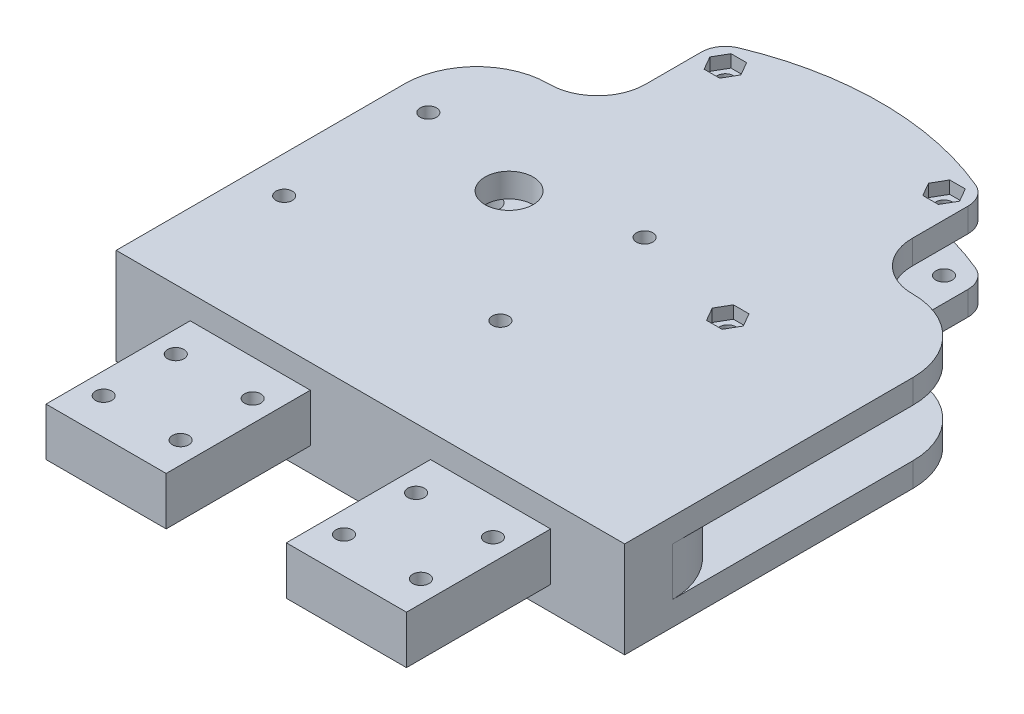
from build123d import *

# Parameters (mm, degrees)
SKETCH1_R               = 2.3
SKETCH1_R_2             = 1.7
BOSS_EXTRUDE2_DEPTH     = 5
SKETCH2_R               = 1.7
BOSS_EXTRUDE4_DEPTH     = 5
BOSS_EXTRUDE7_DEPTH     = 5
BOSS_EXTRUDE8_DEPTH     = 10
BOSS_EXTRUDE9_START     = 5
SKETCH6_R               = 1.7
SKETCH6_R_2             = 5
BOSS_EXTRUDE9_DEPTH     = 5
SKETCH7_W               = 10
SKETCH7_H               = 10
BOSS_EXTRUDE10_DEPTH    = 30
SKETCH9_W               = 7.5
SKETCH9_H               = 30
SKETCH9_R               = 1.7
BOSS_EXTRUDE11_DEPTH    = 10
FILLET1_R               = 10
CUT_EXTRUDE1_DEPTH      = 2.7
CUT_EXTRUDE1_DEPTH_BACK = 2.6
CUT_EXTRUDE2_DEPTH      = 2.7
CUT_EXTRUDE2_DEPTH_BACK = 2.6
CUT_EXTRUDE4_DEPTH      = 2.6
BOSS_EXTRUDE12_DEPTH    = 10


with BuildPart() as part:
    # Sketch1 → Boss-Extrude2 (new body)
    with BuildSketch(Plane(origin=(0, 0, 0), x_dir=(1, 0, 0), z_dir=(0, 1, 0))):
        with BuildLine():
            Line((15.15, -32.7), (-15.15, -32.7))
            ThreePointArc((-15.15, -32.7), (-25.756601718, -28.306601718), (-30.15, -17.7))
            Line((-30.15, -17.7), (-30.15, 17.7))
            ThreePointArc((-30.15, 17.7), (-25.756601718, 28.306601718), (-15.15, 32.7))
            Line((-15.15, 32.7), (15.15, 32.7))
            ThreePointArc((15.15, 32.7), (25.756601718, 28.306601718), (30.15, 17.7))
            Line((30.15, 17.7), (30.15, -17.7))
            ThreePointArc((30.15, -17.7), (25.756601718, -28.306601718), (15.15, -32.7))
        make_face()
        with Locations(Location((-15, 20, 0), (0, 0, 270))):
            Circle(SKETCH1_R, mode=Mode.SUBTRACT)
        with Locations(Location((-25, 0, 0), (0, 0, 270))):
            Circle(SKETCH1_R, mode=Mode.SUBTRACT)
        with Locations(Location((-15, -20, 0), (0, 0, 270))):
            Circle(SKETCH1_R, mode=Mode.SUBTRACT)
        with Locations(Location((-22.5, 15, 0), (0, 0, 270))):
            Circle(SKETCH1_R_2, mode=Mode.SUBTRACT)
        with Locations(Location((-22.5, -15, 0), (0, 0, 270))):
            Circle(SKETCH1_R_2, mode=Mode.SUBTRACT)
        with Locations(Location((15, -20, 0), (0, 0, 90))):
            Circle(SKETCH1_R, mode=Mode.SUBTRACT)
        with Locations(Location((22.5, -15, 0), (0, 0, 90))):
            Circle(SKETCH1_R_2, mode=Mode.SUBTRACT)
        with Locations(Location((25, 0, 0), (0, 0, 90))):
            Circle(SKETCH1_R, mode=Mode.SUBTRACT)
        with Locations(Location((22.5, 15, 0), (0, 0, 90))):
            Circle(SKETCH1_R_2, mode=Mode.SUBTRACT)
        with Locations(Location((15, 20, 0), (0, 0, 90))):
            Circle(SKETCH1_R, mode=Mode.SUBTRACT)
        with BuildLine():
            Line((-9, 4.716333345), (-9, -16.9))
            Line((-9, -16.9), (9, -16.9))
            Line((9, -16.9), (9, 4.716333345))
            ThreePointArc((9, 4.716333345), (0, 19.4), (-9, 4.716333345))
        make_face(mode=Mode.SUBTRACT)
    extrude(amount=BOSS_EXTRUDE2_DEPTH)

    # Sketch2 → Boss-Extrude4 (add)
    with BuildSketch(Plane(origin=(0, 5, 0), x_dir=(1, 0, 0), z_dir=(0, 1, 0))):
        with BuildLine():
            Line((60.65, -32.7), (15.35, -32.7))
            Line((15.35, -32.7), (28.35, -18.600497512))
            Line((28.35, -18.600497512), (28.35, 18.600497512))
            Line((28.35, 18.600497512), (15.35, 32.7))
            Line((15.35, 32.7), (-5, 32.7))
            Line((-5, 32.7), (-5, 54.3))
            ThreePointArc((-5, 54.3), (-4.162967345, 57.069422843), (-1.932118848, 58.911606744))
            ThreePointArc((-1.932118848, 58.911606744), (22.75, 63.873189993), (47.432118848, 58.911606744))
            ThreePointArc((47.432118848, 58.911606744), (49.662967345, 57.069422843), (50.5, 54.3))
            Line((50.5, 54.3), (50.5, 32.7))
            Line((50.5, 32.7), (60.65, 32.7))
            ThreePointArc((60.65, 32.7), (71.256601718, 28.306601718), (75.65, 17.7))
            Line((75.65, 17.7), (75.65, -17.7))
            ThreePointArc((75.65, -17.7), (71.256601718, -28.306601718), (60.65, -32.7))
        make_face()
        with Locations(Location((45.5, 9.3, 0), (0, 0, 270))):
            Circle(SKETCH2_R, mode=Mode.SUBTRACT)
        with Locations(Location((45.5, 54.3, 0), (0, 0, 270))):
            Circle(SKETCH2_R, mode=Mode.SUBTRACT)
        with Locations(Location((0, 54.3, 0), (0, 0, 270))):
            Circle(SKETCH2_R, mode=Mode.SUBTRACT)
    extrude(amount=-BOSS_EXTRUDE4_DEPTH)

    # Sketch4 → Boss-Extrude7 (add)
    with BuildSketch(Plane(origin=(0, 5, 0), x_dir=(1, 0, 0), z_dir=(0, 1, 0))):
        Polygon((-30.15, -17.7), (-15.15, -32.7), (60.65, -32.7), (75.65, -17.7), (75.65, -42.3), (-30.15, -42.3), align=None)
    extrude(amount=-BOSS_EXTRUDE7_DEPTH)

    # Sketch5 → Boss-Extrude8 (add)
    with BuildSketch(Plane(origin=(0, 5, 0), x_dir=(1, 0, 0), z_dir=(0, 1, 0))):
        with BuildLine():
            Line((-30.15, -42.3), (75.65, -42.3))
            Line((75.65, -42.3), (75.65, -32.3))
            ThreePointArc((75.65, -32.3), (71.256601718, -21.693398282), (60.65, -17.3))
            Line((60.65, -17.3), (-15.15, -17.3))
            ThreePointArc((-15.15, -17.3), (-25.756601718, -21.693398282), (-30.15, -32.3))
            Line((-30.15, -32.3), (-30.15, -42.3))
        make_face()
    extrude(amount=BOSS_EXTRUDE8_DEPTH)

    # Sketch6 → Boss-Extrude9 (add)
    with BuildSketch(Plane(origin=(0, 15, 0), x_dir=(1, 0, 0), z_dir=(0, 1, 0)).offset(BOSS_EXTRUDE9_START)):
        with BuildLine():
            Line((-30.15, -42.3), (-30.15, 17.7))
            ThreePointArc((-30.15, 17.7), (-25.756601718, 28.306601718), (-15.15, 32.7))
            Line((-15.15, 32.7), (-5, 32.7))
            Line((-5, 32.7), (-5, 54.3))
            ThreePointArc((-5, 54.3), (-4.162967345, 57.069422843), (-1.932118848, 58.911606744))
            ThreePointArc((-1.932118848, 58.911606744), (22.75, 63.873189993), (47.432118848, 58.911606744))
            ThreePointArc((47.432118848, 58.911606744), (49.662967345, 57.069422843), (50.5, 54.3))
            Line((50.5, 54.3), (50.5, 32.7))
            Line((50.5, 32.7), (60.65, 32.7))
            ThreePointArc((60.65, 32.7), (71.256601718, 28.306601718), (75.65, 17.7))
            Line((75.65, 17.7), (75.65, -42.3))
            Line((75.65, -42.3), (-30.15, -42.3))
        make_face()
        with Locations(Location((-22.5, 15, 0), (0, 0, 270))):
            Circle(SKETCH6_R, mode=Mode.SUBTRACT)
        with Locations(Location((-22.5, -15, 0), (0, 0, 270))):
            Circle(SKETCH6_R, mode=Mode.SUBTRACT)
        with Locations(Location((22.5, -15, 0), (0, 0, 90))):
            Circle(SKETCH6_R, mode=Mode.SUBTRACT)
        with Locations(Location((22.5, 15, 0), (0, 0, 90))):
            Circle(SKETCH6_R, mode=Mode.SUBTRACT)
        with Locations(Location((45.5, 9.3, 0), (0, 0, 270))):
            Circle(SKETCH6_R, mode=Mode.SUBTRACT)
        with Locations(Location((0, 9.3, 0), (0, 0, 270))):
            Circle(SKETCH6_R_2, mode=Mode.SUBTRACT)
        with Locations(Location((45.5, 54.3, 0), (0, 0, 270))):
            Circle(SKETCH6_R, mode=Mode.SUBTRACT)
        with Locations(Location((0, 54.3, 0), (0, 0, 270))):
            Circle(SKETCH6_R, mode=Mode.SUBTRACT)
    extrude(amount=-BOSS_EXTRUDE9_DEPTH)

    # Sketch7 → Boss-Extrude10 (add)
    with BuildSketch(Plane.XY.offset(42.3)):
        with Locations((-2.25, 10)):
            Rectangle(SKETCH7_W, SKETCH7_H)
        with Locations((47.75, 10)):
            Rectangle(SKETCH7_W, SKETCH7_H)
    extrude(amount=BOSS_EXTRUDE10_DEPTH)

    # Sketch9 → Boss-Extrude11 (add)
    # profile 1 of 4: a face of its own
    with BuildSketch(Plane(origin=(0, 15, 0), x_dir=(1, 0, 0), z_dir=(0, 1, 0))):
        with Locations((-11, -57.3)):
            Rectangle(SKETCH9_W, SKETCH9_H)
        with Locations(Location((-10.25, -49.8, 0), (0, 0, 180))):
            Circle(SKETCH9_R, mode=Mode.SUBTRACT)
        with Locations((-10.25, -64.8)):
            Circle(SKETCH9_R, mode=Mode.SUBTRACT)
    # profile 2 of 4: a face of its own
    with BuildSketch(Plane(origin=(0, 15, 0), x_dir=(1, 0, 0), z_dir=(0, 1, 0))):
        with Locations((6.5, -57.3)):
            Rectangle(SKETCH9_W, SKETCH9_H)
        with Locations(Location((5.75, -64.8, 0), (0, 0, 180))):
            Circle(SKETCH9_R, mode=Mode.SUBTRACT)
        with Locations((5.75, -49.8)):
            Circle(SKETCH9_R, mode=Mode.SUBTRACT)
    # profile 3 of 4: a face of its own
    with BuildSketch(Plane(origin=(0, 15, 0), x_dir=(1, 0, 0), z_dir=(0, 1, 0))):
        with Locations((39, -57.3)):
            Rectangle(SKETCH9_W, SKETCH9_H)
        with Locations((39.75, -64.8)):
            Circle(SKETCH9_R, mode=Mode.SUBTRACT)
        with Locations(Location((39.75, -49.8, 0), (0, 0, 180))):
            Circle(SKETCH9_R, mode=Mode.SUBTRACT)
    # profile 4 of 4: a face of its own
    with BuildSketch(Plane(origin=(0, 15, 0), x_dir=(1, 0, 0), z_dir=(0, 1, 0))):
        with Locations((56.5, -57.3)):
            Rectangle(SKETCH9_W, SKETCH9_H)
        with Locations(Location((55.75, -64.8, 0), (0, 0, 180))):
            Circle(SKETCH9_R, mode=Mode.SUBTRACT)
        with Locations((55.75, -49.8)):
            Circle(SKETCH9_R, mode=Mode.SUBTRACT)
    extrude(amount=-BOSS_EXTRUDE11_DEPTH)

    # Fillet1
    # the kernel refuses this fillet: 10 mm, written as the material it adds along each edge
    with BuildSketch(Plane(origin=(-5, 30, -32.7), x_dir=(0, 0, -1), z_dir=(0, -1, 0))) as fillet1_piece_1_section:
        with BuildLine():
            CenterArc((FILLET1_R, -FILLET1_R), FILLET1_R, 90, 90)
            Line((0, -FILLET1_R), (0, 0))
            Line((0, 0), (FILLET1_R, 0))
        make_face()
    fillet1_piece_1 = extrude(amount=30, mode=Mode.PRIVATE)
    fillet1_piece_1 = split(fillet1_piece_1, bisect_by=Plane(origin=(-7.263951143, 15, -34.963951143), z_dir=(0, 1, 0)), keep=Keep.TOP, mode=Mode.PRIVATE)
    fillet1_piece_1 = split(fillet1_piece_1, bisect_by=Plane(origin=(-7.263951143, 20, -34.963951143), z_dir=(0, -1, 0)), keep=Keep.TOP, mode=Mode.PRIVATE)
    add(fillet1_piece_1)
    with BuildSketch(Plane(origin=(-5, 5, -32.7), x_dir=(0, 0, -1), z_dir=(0, -1, 0)), Plane(origin=(50.5, 5, -32.7), x_dir=(1, 0, 0), z_dir=(0, -1, 0))) as fillet1_piece_2:
        with BuildLine():
            CenterArc((FILLET1_R, -FILLET1_R), FILLET1_R, 90, 90)
            Line((0, -FILLET1_R), (0, 0))
            Line((0, 0), (FILLET1_R, 0))
        make_face()
    extrude(amount=5)
    with BuildSketch(Plane(origin=(50.5, 30, -32.7), x_dir=(1, 0, 0), z_dir=(0, -1, 0))) as fillet1_piece_3_section:
        with BuildLine():
            CenterArc((FILLET1_R, -FILLET1_R), FILLET1_R, 90, 90)
            Line((0, -FILLET1_R), (0, 0))
            Line((0, 0), (FILLET1_R, 0))
        make_face()
    fillet1_piece_3 = extrude(amount=30, mode=Mode.PRIVATE)
    fillet1_piece_3 = split(fillet1_piece_3, bisect_by=Plane(origin=(52.763951143, 15, -34.963951143), z_dir=(0, 1, 0)), keep=Keep.TOP, mode=Mode.PRIVATE)
    fillet1_piece_3 = split(fillet1_piece_3, bisect_by=Plane(origin=(52.763951143, 20, -34.963951143), z_dir=(0, -1, 0)), keep=Keep.TOP, mode=Mode.PRIVATE)
    add(fillet1_piece_3)
    with BuildSketch(Plane(origin=(50.5, 20, -32.7), x_dir=(0, 0, -1), z_dir=(0, -1, 0)), Plane(origin=(-5, 20, -32.7), x_dir=(-1, 0, 0), z_dir=(0, -1, 0))) as fillet1_piece_4:
        with BuildLine():
            CenterArc((FILLET1_R, FILLET1_R), FILLET1_R, 180, 90)
            Line((0, FILLET1_R), (0, 0))
            Line((0, 0), (FILLET1_R, 0))
        make_face()
    extrude(amount=5)
    with BuildSketch(Plane(origin=(50.5, 20, -32.7), x_dir=(0, 0, -1), z_dir=(0, -1, 0))) as fillet1_piece_5_section:
        with BuildLine():
            CenterArc((FILLET1_R, FILLET1_R), FILLET1_R, 180, 90)
            Line((0, FILLET1_R), (0, 0))
            Line((0, 0), (FILLET1_R, 0))
        make_face()
    fillet1_piece_5 = extrude(amount=30, mode=Mode.PRIVATE)
    fillet1_piece_5 = split(fillet1_piece_5, bisect_by=Plane(origin=(52.763951143, 0, -34.963951143), z_dir=(0, 1, 0)), keep=Keep.TOP, mode=Mode.PRIVATE)
    fillet1_piece_5 = split(fillet1_piece_5, bisect_by=Plane(origin=(52.763951143, 5, -34.963951143), z_dir=(0, -1, 0)), keep=Keep.TOP, mode=Mode.PRIVATE)
    add(fillet1_piece_5)
    with BuildSketch(Plane(origin=(-5, 20, -32.7), x_dir=(-1, 0, 0), z_dir=(0, -1, 0))) as fillet1_piece_6_section:
        with BuildLine():
            CenterArc((FILLET1_R, FILLET1_R), FILLET1_R, 180, 90)
            Line((0, FILLET1_R), (0, 0))
            Line((0, 0), (FILLET1_R, 0))
        make_face()
    fillet1_piece_6 = extrude(amount=30, mode=Mode.PRIVATE)
    fillet1_piece_6 = split(fillet1_piece_6, bisect_by=Plane(origin=(-7.263951143, 0, -34.963951143), z_dir=(0, 1, 0)), keep=Keep.TOP, mode=Mode.PRIVATE)
    fillet1_piece_6 = split(fillet1_piece_6, bisect_by=Plane(origin=(-7.263951143, 5, -34.963951143), z_dir=(0, -1, 0)), keep=Keep.TOP, mode=Mode.PRIVATE)
    add(fillet1_piece_6)

    # Sketch10 → Cut-Extrude1 (cut, two sides: drawn at the far end of the back side and taken through both)
    with BuildSketch(Plane(origin=(0, 5, 0), x_dir=(1, 0, 0), z_dir=(0, 1, 0)).offset(-CUT_EXTRUDE1_DEPTH_BACK)):
        Polygon((-19.266838493, 15), (-20.883419246, 17.8), (-24.116580754, 17.8), (-25.733161507, 15), (-24.116580754, 12.2), (-20.883419246, 12.2), align=None)
        Polygon((-25.733161507, -15), (-24.116580754, -12.2), (-20.883419246, -12.2), (-19.266838493, -15), (-20.883419246, -17.8), (-24.116580754, -17.8), align=None)
        Polygon((24.116580754, -12.2), (20.883419246, -12.2), (19.266838493, -15), (20.883419246, -17.8), (24.116580754, -17.8), (25.733161507, -15), align=None)
        Polygon((20.883419246, 12.2), (19.266838493, 15), (20.883419246, 17.8), (24.116580754, 17.8), (25.733161507, 15), (24.116580754, 12.2), align=None)
    extrude(amount=CUT_EXTRUDE1_DEPTH + CUT_EXTRUDE1_DEPTH_BACK, mode=Mode.SUBTRACT)

    # Sketch11 → Cut-Extrude2 (cut, two sides: drawn at the far end of the back side and taken through both)
    with BuildSketch(Plane.XZ.offset(-15).offset(-CUT_EXTRUDE2_DEPTH_BACK)):
        Polygon((-19.266838493, 15), (-20.883419246, 17.8), (-24.116580754, 17.8), (-25.733161507, 15), (-24.116580754, 12.2), (-20.883419246, 12.2), align=None)
        Polygon((-20.883419246, -12.2), (-19.266838493, -15), (-20.883419246, -17.8), (-24.116580754, -17.8), (-25.733161507, -15), (-24.116580754, -12.2), align=None)
        Polygon((19.266838493, -15), (20.883419246, -17.8), (24.116580754, -17.8), (25.733161507, -15), (24.116580754, -12.2), (20.883419246, -12.2), align=None)
        Polygon((20.883419246, 12.2), (19.266838493, 15), (20.883419246, 17.8), (24.116580754, 17.8), (25.733161507, 15), (24.116580754, 12.2), align=None)
    extrude(amount=CUT_EXTRUDE2_DEPTH + CUT_EXTRUDE2_DEPTH_BACK, mode=Mode.SUBTRACT)

    # Sketch13 → Cut-Extrude4 (cut)
    with BuildSketch(Plane(origin=(0, 20, 0), x_dir=(1, 0, 0), z_dir=(0, 1, 0))):
        Polygon((3.233161507, 54.3), (1.616580754, 57.1), (-1.616580754, 57.1), (-3.233161507, 54.3), (-1.616580754, 51.5), (1.616580754, 51.5), align=None)
        Polygon((48.733161507, 54.3), (47.116580754, 57.1), (43.883419246, 57.1), (42.266838493, 54.3), (43.883419246, 51.5), (47.116580754, 51.5), align=None)
        Polygon((48.733161507, 9.3), (47.116580754, 12.1), (43.883419246, 12.1), (42.266838493, 9.3), (43.883419246, 6.5), (47.116580754, 6.5), align=None)
    extrude(amount=-CUT_EXTRUDE4_DEPTH, mode=Mode.SUBTRACT)

    # Sketch14 → Boss-Extrude12 (add)
    with BuildSketch(Plane(origin=(0, 5, 0), x_dir=(1, 0, 0), z_dir=(0, 1, 0))):
        with BuildLine():
            Line((27.75, 58.873189993), (27.75, 33.873189993))
            ThreePointArc((27.75, 33.873189993), (22.75, 28.873189993), (17.75, 33.873189993))
            Line((17.75, 33.873189993), (17.75, 58.873189993))
            ThreePointArc((17.75, 58.873189993), (22.75, 63.873189993), (27.75, 58.873189993))
        make_face()
    extrude(amount=BOSS_EXTRUDE12_DEPTH)


solid = part.part
